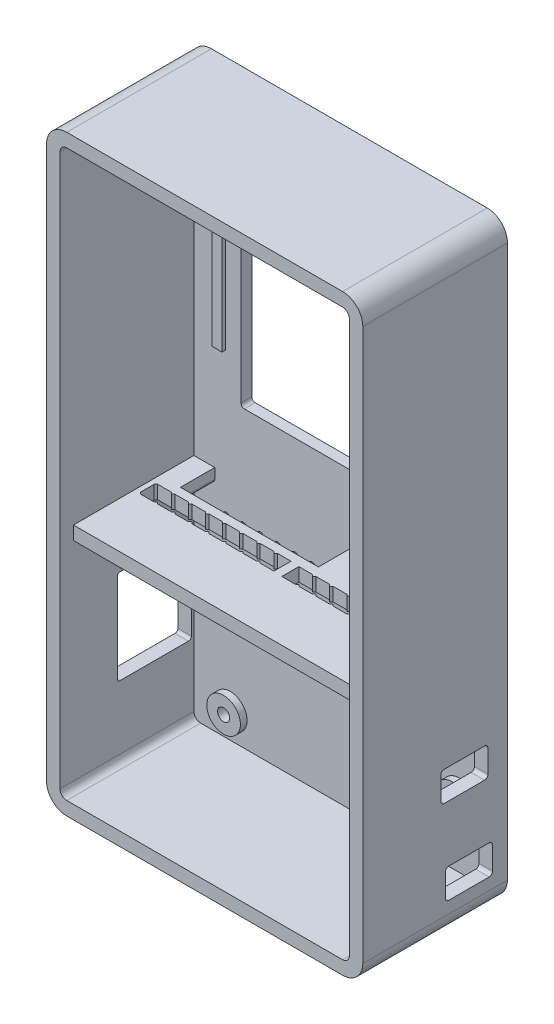
from build123d import *

# Parameters (mm, degrees)
OUTER_CASE_PROFILE_W            = 47
OUTER_CASE_PROFILE_H            = 88
OUTER_CASE_BLOCK_DEPTH          = 10.75
OUTER_CORNER_FILLETS_R          = 3
MAIN_INTERNAL_CAVITY_DEPTH      = 19.9
DISPLAY_WINDOW_CUT_DEPTH        = 54.705307
DISPLAY_SUPPORT_RAILS_PROFILE_W = 1.5
DISPLAY_SUPPORT_RAILS_PROFILE_H = 44
DISPLAY_SUPPORT_RAILS_DEPTH     = 0.5
SEPARATOR_PROFILE_W             = 43
SEPARATOR_PROFILE_H             = 2
SEPARATOR_RIB_DEPTH             = 17.9
DISPLAY_CABLE_SLOT_PROFILE_W    = 20.5
DISPLAY_CABLE_SLOT_PROFILE_H    = 5.1
DISPLAY_CABLE_SLOT_CUT_DEPTH    = 17.9
CABLE_SLOT_FILLETS_R            = 0.5
PCB_MOUNTING_BOSSES_PROFILE_R   = 2.5
PCB_MOUNTING_BOSSES_DEPTH       = 1
PCB_BOSS_PILOT_HOLES_PROFILE_R  = 0.9
PCB_BOSS_PILOT_HOLES_DEPTH      = 2
CUT_EXTRUDE3_REACH              = 56.319
SKETCH3_R                       = 0.502
CUT_EXTRUDE3_DIRECTION_2_DEPTH  = 0.3
BOSS_EXTRUDE3_OUTLINE_R         = 0.502
BOSS_EXTRUDE3_DEPTH             = 0.5
SKETCH4_W                       = 2.216296008
SKETCH4_H                       = 1.7
CUT_EXTRUDE4_DEPTH              = 1.6
BOSS_EXTRUDE4_START             = -1.1
SKETCH4_3_W                     = 2.216296008
SKETCH4_3_H                     = 1.7
BOSS_EXTRUDE4_DEPTH             = 1
CUT_EXTRUDE5_DEPTH              = 2
CUT_EXTRUDE6_DEPTH              = 2


# Read off the part's stored shape, not the designer's step: Boss-Extrude3
with BuildPart() as part:
    # Outer_Case_Profile → Outer_Case_Block (new, symmetric)
    with BuildSketch(Plane.XY):
        Rectangle(OUTER_CASE_PROFILE_W, OUTER_CASE_PROFILE_H)
    extrude(amount=OUTER_CASE_BLOCK_DEPTH, both=True)

    # Outer_Corner_Fillets
    outer_corner_fillets_edges = [part.edges().sort_by_distance(p)[0] for p in [
        (23.5, -44, 0),
        (-23.5, -44, 0),
        (-23.5, 44, 0),
        (23.5, 44, 0),
    ]]
    fillet(outer_corner_fillets_edges, radius=OUTER_CORNER_FILLETS_R)

    # Main_Internal_Cavity_Profile → Main_Internal_Cavity (cut)
    with BuildSketch(Plane.XY.offset(10.75)):
        with BuildLine():
            Line((-20.5, -42), (20.5, -42))
            ThreePointArc((20.5, -42), (21.207106781, -41.707106781), (21.5, -41))
            Line((21.5, -41), (21.5, 41))
            ThreePointArc((21.5, 41), (21.207106781, 41.707106781), (20.5, 42))
            Line((20.5, 42), (-20.5, 42))
            ThreePointArc((-20.5, 42), (-21.207106781, 41.707106781), (-21.5, 41))
            Line((-21.5, 41), (-21.5, -41))
            ThreePointArc((-21.5, -41), (-21.207106781, -41.707106781), (-20.5, -42))
        make_face()
    extrude(amount=-MAIN_INTERNAL_CAVITY_DEPTH, mode=Mode.SUBTRACT)

    # Display_Window_Profile → Display_Window_Cut (cut, through all)
    with BuildSketch(Plane.XY.offset(-9.15)):
        with BuildLine():
            Line((14, 30.7), (-14, 30.7))
            ThreePointArc((-14, 30.7), (-14.353553391, 30.553553391), (-14.5, 30.2))
            Line((-14.5, 30.2), (-14.5, 2.2))
            ThreePointArc((-14.5, 2.2), (-14.353553391, 1.846446609), (-14, 1.7))
            Line((-14, 1.7), (14, 1.7))
            ThreePointArc((14, 1.7), (14.353553391, 1.846446609), (14.5, 2.2))
            Line((14.5, 2.2), (14.5, 30.2))
            ThreePointArc((14.5, 30.2), (14.353553391, 30.553553391), (14, 30.7))
        make_face()
    extrude(amount=-DISPLAY_WINDOW_CUT_DEPTH, mode=Mode.SUBTRACT)

    # Display_Support_Rails_Profile → Display_Support_Rails (add, symmetric)
    with BuildSketch(Plane.XY.offset(-9.15)):
        with Locations((17.55, 16.2)):
            Rectangle(DISPLAY_SUPPORT_RAILS_PROFILE_W, DISPLAY_SUPPORT_RAILS_PROFILE_H)
        with Locations((-17.55, 16.2)):
            Rectangle(DISPLAY_SUPPORT_RAILS_PROFILE_W, DISPLAY_SUPPORT_RAILS_PROFILE_H)
    extrude(amount=DISPLAY_SUPPORT_RAILS_DEPTH, both=True)

    # Separator_Profile → Separator_Rib (add)
    with BuildSketch(Plane.XY.offset(-9.15)):
        with Locations((0, -9.05)):
            Rectangle(SEPARATOR_PROFILE_W, SEPARATOR_PROFILE_H)
    extrude(amount=SEPARATOR_RIB_DEPTH)

    # Display_Cable_Slot_Profile → Display_Cable_Slot_cut (cut)
    with BuildSketch(Plane.XZ.offset(10.05)):
        with Locations((-8.15, -6.6)):
            Rectangle(DISPLAY_CABLE_SLOT_PROFILE_W, DISPLAY_CABLE_SLOT_PROFILE_H)
        Polygon((-0.679395553, -0.215002723), (-2.711395553, -0.215002723), (-2.965395553, -0.469002723), (-3.219395553, -0.215002723), (-5.251395553, -0.215002723), (-5.505395553, -0.469002723), (-5.759395553, -0.215002723), (-7.791395553, -0.215002723), (-8.045395553, -0.469002723), (-8.299395553, -0.215002723), (-10.331395553, -0.215002723), (-10.585395553, -0.469002723), (-10.839395553, -0.215002723), (-12.871395553, -0.215002723), (-13.125395553, -0.469002723), (-13.379395553, -0.215002723), (-15.411395553, -0.215002723), (-15.665395553, -0.469002723), (-15.919395553, -0.215002723), (-17.951395553, -0.215002723), (-18.205395553, -0.469002723), (-18.459395553, -0.215002723), (-20.491395553, -0.215002723), (-20.745395553, -0.469002723), (-20.745395553, -2.501002723), (-20.491395553, -2.755002723), (-18.459395553, -2.755002723), (-18.205395553, -2.501002723), (-17.951395553, -2.755002723), (-15.919395553, -2.755002723), (-15.665395553, -2.501002723), (-15.411395553, -2.755002723), (-13.379395553, -2.755002723), (-13.125395553, -2.501002723), (-12.871395553, -2.755002723), (-10.839395553, -2.755002723), (-10.585395553, -2.501002723), (-10.331395553, -2.755002723), (-8.299395553, -2.755002723), (-8.045395553, -2.501002723), (-7.791395553, -2.755002723), (-5.759395553, -2.755002723), (-5.505395553, -2.501002723), (-5.251395553, -2.755002723), (-3.219395553, -2.755002723), (-2.965395553, -2.501002723), (-2.711395553, -2.755002723), (-0.679395553, -2.755002723), align=None)
        Polygon((0.607123746, -2.651780318), (2.639123746, -2.651780318), (2.893123746, -2.397780318), (3.147123746, -2.651780318), (5.179123746, -2.651780318), (5.433123746, -2.397780318), (5.687123746, -2.651780318), (7.719123746, -2.651780318), (7.973123746, -2.397780318), (8.227123746, -2.651780318), (10.259123746, -2.651780318), (10.513123746, -2.397780318), (10.767123746, -2.651780318), (12.799123746, -2.651780318), (13.053123746, -2.397780318), (13.307123746, -2.651780318), (15.339123746, -2.651780318), (15.593123746, -2.397780318), (15.847123746, -2.651780318), (17.879123746, -2.651780318), (18.133123746, -2.397780318), (18.387123746, -2.651780318), (20.419123746, -2.651780318), (20.673123746, -2.397780318), (20.673123746, -0.365780318), (20.419123746, -0.111780318), (18.387123746, -0.111780318), (18.133123746, -0.365780318), (17.879123746, -0.111780318), (15.847123746, -0.111780318), (15.593123746, -0.365780318), (15.339123746, -0.111780318), (13.307123746, -0.111780318), (13.053123746, -0.365780318), (12.799123746, -0.111780318), (10.767123746, -0.111780318), (10.513123746, -0.365780318), (10.259123746, -0.111780318), (8.227123746, -0.111780318), (7.973123746, -0.365780318), (7.719123746, -0.111780318), (5.687123746, -0.111780318), (5.433123746, -0.365780318), (5.179123746, -0.111780318), (3.147123746, -0.111780318), (2.893123746, -0.365780318), (2.639123746, -0.111780318), (0.607123746, -0.111780318), align=None)
    extrude(amount=-DISPLAY_CABLE_SLOT_CUT_DEPTH, mode=Mode.SUBTRACT)

    # Cable_Slot_Fillets
    cable_slot_fillets_edges = [part.edges().sort_by_distance(p)[0] for p in [
        (2.1, -10.05, -6.6),
        (-18.4, -10.05, -6.6),
    ]]
    fillet(cable_slot_fillets_edges, radius=CABLE_SLOT_FILLETS_R)

    # PCB_Mounting_Bosses_Profile → PCB_Mounting_Bosses (add, symmetric)
    with BuildSketch(Plane.XY.offset(-9.15)):
        with Locations((-16.09, -38.215)):
            Circle(PCB_MOUNTING_BOSSES_PROFILE_R)
        with Locations((17.13, -12.87)):
            Circle(PCB_MOUNTING_BOSSES_PROFILE_R)
        with Locations((17.9, -32.345)):
            Circle(PCB_MOUNTING_BOSSES_PROFILE_R)
    extrude(amount=PCB_MOUNTING_BOSSES_DEPTH, both=True)

    # PCB_Boss_Pilot_Holes_profile → PCB_Boss_Pilot_Holes (cut)
    with BuildSketch(Plane.XY.offset(-8.15)):
        with Locations((17.9, -32.345)):
            Circle(PCB_BOSS_PILOT_HOLES_PROFILE_R)
        with Locations((-16.09, -38.215)):
            Circle(PCB_BOSS_PILOT_HOLES_PROFILE_R)
        with Locations((17.13, -12.87)):
            Circle(PCB_BOSS_PILOT_HOLES_PROFILE_R)
    extrude(amount=-PCB_BOSS_PILOT_HOLES_DEPTH, mode=Mode.SUBTRACT)

    # Sketch3 → Cut-Extrude3 (cut, up to next)
    with BuildSketch(Plane(origin=(0, 0, -10.75), x_dir=(-1, 0, 0), z_dir=(0, 0, -1)), mode=Mode.PRIVATE) as cut_extrude3_sk1:
        with Locations(Location((1.40354211, -13.45365433, 0), (0, 0, 180))):
            Circle(SKETCH3_R)
    cut_extrude3_tool1 = extrude(cut_extrude3_sk1.sketch, amount=-CUT_EXTRUDE3_REACH, mode=Mode.PRIVATE) & part.part
    # Sketch3 → Cut-Extrude3 (cut, up to next)
    with BuildSketch(Plane(origin=(0, 0, -10.75), x_dir=(-1, 0, 0), z_dir=(0, 0, -1)), mode=Mode.PRIVATE) as cut_extrude3_sk2:
        with Locations(Location((3.95354211, -13.45365433, 0), (0, 0, 180))):
            Circle(SKETCH3_R)
    cut_extrude3_tool2 = extrude(cut_extrude3_sk2.sketch, amount=-CUT_EXTRUDE3_REACH, mode=Mode.PRIVATE) & part.part
    # Sketch3 → Cut-Extrude3 (cut, up to next)
    with BuildSketch(Plane(origin=(0, 0, -10.75), x_dir=(-1, 0, 0), z_dir=(0, 0, -1)), mode=Mode.PRIVATE) as cut_extrude3_sk3:
        with Locations(Location((-1.14645789, -13.45365433, 0), (0, 0, 180))):
            Circle(SKETCH3_R)
    cut_extrude3_tool3 = extrude(cut_extrude3_sk3.sketch, amount=-CUT_EXTRUDE3_REACH, mode=Mode.PRIVATE) & part.part
    # Sketch3 → Cut-Extrude3 (cut, up to next)
    with BuildSketch(Plane(origin=(0, 0, -10.75), x_dir=(-1, 0, 0), z_dir=(0, 0, -1)), mode=Mode.PRIVATE) as cut_extrude3_sk4:
        with Locations(Location((6.50354211, -13.45365433, 0), (0, 0, 180))):
            Circle(SKETCH3_R)
    cut_extrude3_tool4 = extrude(cut_extrude3_sk4.sketch, amount=-CUT_EXTRUDE3_REACH, mode=Mode.PRIVATE) & part.part
    # Sketch3 → Cut-Extrude3 (cut, up to next)
    with BuildSketch(Plane(origin=(0, 0, -10.75), x_dir=(-1, 0, 0), z_dir=(0, 0, -1)), mode=Mode.PRIVATE) as cut_extrude3_sk5:
        with Locations(Location((9.05354211, -13.45365433, 0), (0, 0, 180))):
            Circle(SKETCH3_R)
    cut_extrude3_tool5 = extrude(cut_extrude3_sk5.sketch, amount=-CUT_EXTRUDE3_REACH, mode=Mode.PRIVATE) & part.part
    # Sketch3 → Cut-Extrude3 (cut, up to next)
    with BuildSketch(Plane(origin=(0, 0, -10.75), x_dir=(-1, 0, 0), z_dir=(0, 0, -1)), mode=Mode.PRIVATE) as cut_extrude3_sk6:
        with Locations(Location((11.60354211, -13.45365433, 0), (0, 0, 180))):
            Circle(SKETCH3_R)
    cut_extrude3_tool6 = extrude(cut_extrude3_sk6.sketch, amount=-CUT_EXTRUDE3_REACH, mode=Mode.PRIVATE) & part.part
    # Sketch3 → Cut-Extrude3 (cut, up to next)
    with BuildSketch(Plane(origin=(0, 0, -10.75), x_dir=(-1, 0, 0), z_dir=(0, 0, -1)), mode=Mode.PRIVATE) as cut_extrude3_sk7:
        with Locations(Location((14.15354211, -13.45365433, 0), (0, 0, 180))):
            Circle(SKETCH3_R)
    cut_extrude3_tool7 = extrude(cut_extrude3_sk7.sketch, amount=-CUT_EXTRUDE3_REACH, mode=Mode.PRIVATE) & part.part
    # Sketch3 → Cut-Extrude3 (cut, up to next)
    with BuildSketch(Plane(origin=(0, 0, -10.75), x_dir=(-1, 0, 0), z_dir=(0, 0, -1)), mode=Mode.PRIVATE) as cut_extrude3_sk8:
        with Locations(Location((16.70354211, -13.45365433, 0), (0, 0, 180))):
            Circle(SKETCH3_R)
    cut_extrude3_tool8 = extrude(cut_extrude3_sk8.sketch, amount=-CUT_EXTRUDE3_REACH, mode=Mode.PRIVATE) & part.part
    add(cut_extrude3_tool1.solids().sort_by_distance((-1.403542, -13.453654, -10.75))[0], mode=Mode.SUBTRACT)
    add(cut_extrude3_tool2.solids().sort_by_distance((-3.953542, -13.453654, -10.75))[0], mode=Mode.SUBTRACT)
    add(cut_extrude3_tool3.solids().sort_by_distance((1.146458, -13.453654, -10.75))[0], mode=Mode.SUBTRACT)
    add(cut_extrude3_tool4.solids().sort_by_distance((-6.503542, -13.453654, -10.75))[0], mode=Mode.SUBTRACT)
    add(cut_extrude3_tool5.solids().sort_by_distance((-9.053542, -13.453654, -10.75))[0], mode=Mode.SUBTRACT)
    add(cut_extrude3_tool6.solids().sort_by_distance((-11.603542, -13.453654, -10.75))[0], mode=Mode.SUBTRACT)
    add(cut_extrude3_tool7.solids().sort_by_distance((-14.153542, -13.453654, -10.75))[0], mode=Mode.SUBTRACT)
    add(cut_extrude3_tool8.solids().sort_by_distance((-16.703542, -13.453654, -10.75))[0], mode=Mode.SUBTRACT)

    # Sketch3 → Cut-Extrude3 direction 2 (cut)
    with BuildSketch(Plane(origin=(0, 0, -10.75), x_dir=(-1, 0, 0), z_dir=(0, 0, -1))):
        with Locations(Location((1.40354211, -13.45365433, 0), (0, 0, 180))):
            Circle(SKETCH3_R)
        with Locations(Location((3.95354211, -13.45365433, 0), (0, 0, 180))):
            Circle(SKETCH3_R)
        with Locations(Location((-1.14645789, -13.45365433, 0), (0, 0, 180))):
            Circle(SKETCH3_R)
        with Locations(Location((6.50354211, -13.45365433, 0), (0, 0, 180))):
            Circle(SKETCH3_R)
        with Locations(Location((9.05354211, -13.45365433, 0), (0, 0, 180))):
            Circle(SKETCH3_R)
        with Locations(Location((11.60354211, -13.45365433, 0), (0, 0, 180))):
            Circle(SKETCH3_R)
        with Locations(Location((14.15354211, -13.45365433, 0), (0, 0, 180))):
            Circle(SKETCH3_R)
        with Locations(Location((16.70354211, -13.45365433, 0), (0, 0, 180))):
            Circle(SKETCH3_R)
    extrude(amount=CUT_EXTRUDE3_DIRECTION_2_DEPTH, mode=Mode.SUBTRACT)

    # Sketch4 → Cut-Extrude4 (cut)
    with BuildSketch(Plane.XY.offset(-9.15)):
        with Locations((14.20026339, -19.128986104)):
            Rectangle(SKETCH4_W, SKETCH4_H)
        with Locations((16.776559398, -19.043662541)):
            Rectangle(SKETCH4_W, SKETCH4_H)
    extrude(amount=-CUT_EXTRUDE4_DEPTH, mode=Mode.SUBTRACT)

    # Sketch4<3> → Boss-Extrude4 (add)
    with BuildSketch(Plane.XY.offset(-9.15).offset(BOSS_EXTRUDE4_START)):
        with Locations((14.20026339, -19.128986104)):
            Rectangle(SKETCH4_3_W, SKETCH4_3_H)
        with Locations((16.776559398, -19.043662541)):
            Rectangle(SKETCH4_3_W, SKETCH4_3_H)
    extrude(amount=-BOSS_EXTRUDE4_DEPTH)

    # Sketch5 → Cut-Extrude5 (cut)
    with BuildSketch(Plane.ZY.offset(-21.5)):
        with BuildLine():
            Line((-1.349862359, -26.442620265), (-7.349862359, -26.442620265))
            ThreePointArc((-7.349862359, -26.442620265), (-7.70341575, -26.296173655), (-7.849862359, -25.942620265))
            Line((-7.849862359, -25.942620265), (-7.849862359, -22.542620265))
            ThreePointArc((-7.849862359, -22.542620265), (-7.70341575, -22.189066874), (-7.349862359, -22.042620265))
            Line((-7.349862359, -22.042620265), (-1.349862359, -22.042620265))
            ThreePointArc((-1.349862359, -22.042620265), (-0.996308968, -22.189066874), (-0.849862359, -22.542620265))
            Line((-0.849862359, -22.542620265), (-0.849862359, -25.942620265))
            ThreePointArc((-0.849862359, -25.942620265), (-0.996308968, -26.296173655), (-1.349862359, -26.442620265))
        make_face()
        with BuildLine():
            Line((-2.020960404, -39.238150673), (-8.020960404, -39.238150673))
            ThreePointArc((-8.020960404, -39.238150673), (-8.374513795, -39.091704063), (-8.520960404, -38.738150673))
            Line((-8.520960404, -38.738150673), (-8.520960404, -35.338150673))
            ThreePointArc((-8.520960404, -35.338150673), (-8.374513795, -34.984597282), (-8.020960404, -34.838150673))
            Line((-8.020960404, -34.838150673), (-2.020960404, -34.838150673))
            ThreePointArc((-2.020960404, -34.838150673), (-1.667407014, -34.984597282), (-1.520960404, -35.338150673))
            Line((-1.520960404, -35.338150673), (-1.520960404, -38.738150673))
            ThreePointArc((-1.520960404, -38.738150673), (-1.667407014, -39.091704063), (-2.020960404, -39.238150673))
        make_face()
    extrude(amount=-CUT_EXTRUDE5_DEPTH, mode=Mode.SUBTRACT)

    # Sketch6 → Cut-Extrude6 (cut)
    with BuildSketch(Plane(origin=(-21.5, 0, 0), x_dir=(0, 0, -1), z_dir=(1, 0, 0))):
        with BuildLine():
            Line((-1.818480901, -17.53883581), (8.34472049, -17.53883581))
            ThreePointArc((8.34472049, -17.53883581), (8.640573475, -17.661382129), (8.763119794, -17.957235115))
            Line((8.763119794, -17.957235115), (8.763119794, -31.120436506))
            ThreePointArc((8.763119794, -31.120436506), (8.640573475, -31.416289491), (8.34472049, -31.53883581))
            Line((8.34472049, -31.53883581), (-1.818480901, -31.53883581))
            ThreePointArc((-1.818480901, -31.53883581), (-2.114333887, -31.416289491), (-2.236880206, -31.120436506))
            Line((-2.236880206, -31.120436506), (-2.236880206, -17.957235115))
            ThreePointArc((-2.236880206, -17.957235115), (-2.114333887, -17.661382129), (-1.818480901, -17.53883581))
        make_face()
    extrude(amount=-CUT_EXTRUDE6_DEPTH, mode=Mode.SUBTRACT)


with BuildPart() as body_2:
    # Boss-Extrude3 outline → Boss-Extrude3 (new body)
    with BuildSketch(Plane(origin=(0, 0, -10.75), x_dir=(-1, 0, 0), z_dir=(0, 0, -1))):
        with Locations((16.70354211, -13.45365433)):
            Circle(BOSS_EXTRUDE3_OUTLINE_R)
        with Locations((14.15354211, -13.45365433)):
            Circle(BOSS_EXTRUDE3_OUTLINE_R)
        with Locations((11.60354211, -13.45365433)):
            Circle(BOSS_EXTRUDE3_OUTLINE_R)
        with Locations((9.05354211, -13.45365433)):
            Circle(BOSS_EXTRUDE3_OUTLINE_R)
        with Locations((6.50354211, -13.45365433)):
            Circle(BOSS_EXTRUDE3_OUTLINE_R)
        with Locations((3.95354211, -13.45365433)):
            Circle(BOSS_EXTRUDE3_OUTLINE_R)
        with Locations((1.40354211, -13.45365433)):
            Circle(BOSS_EXTRUDE3_OUTLINE_R)
        with Locations((-1.14645789, -13.45365433)):
            Circle(BOSS_EXTRUDE3_OUTLINE_R)
    extrude(amount=BOSS_EXTRUDE3_DEPTH)


solid = Compound([part.part, body_2.part])
